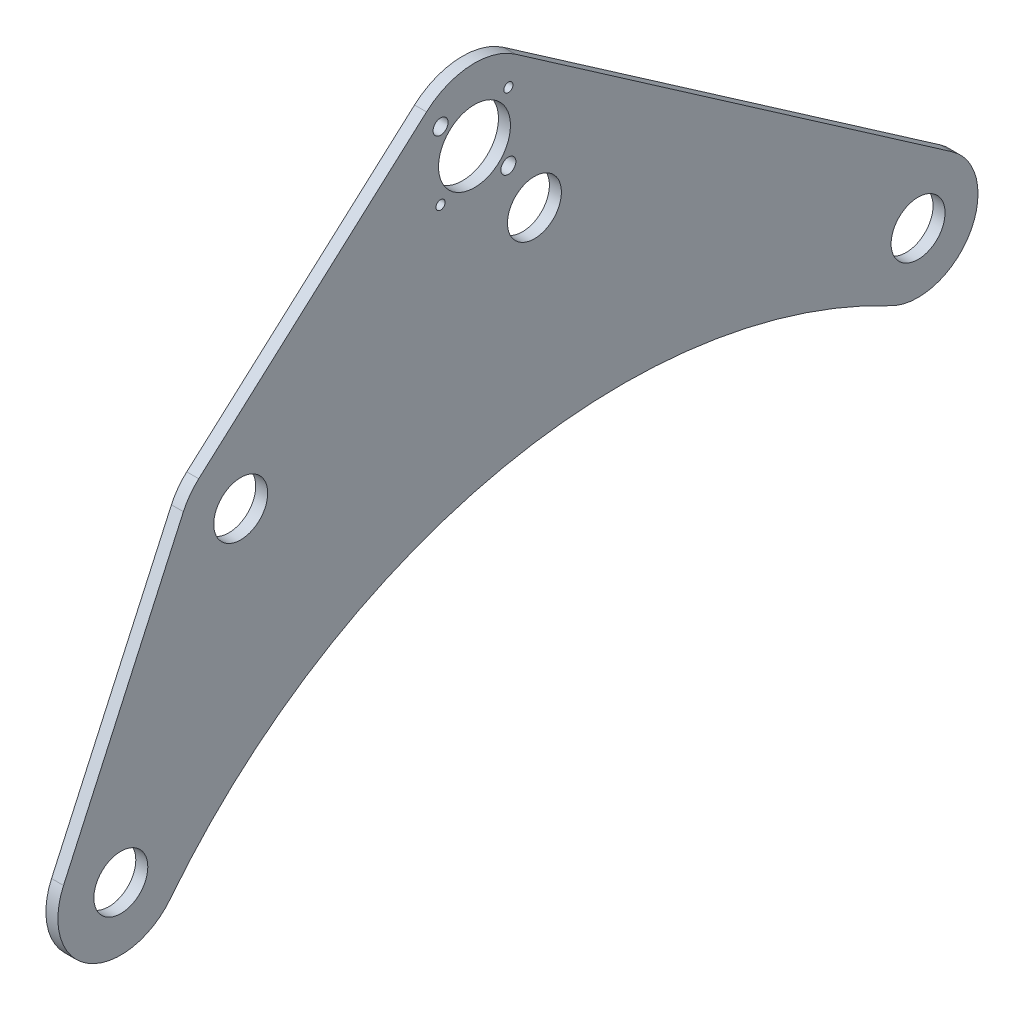
from build123d import *

# Parameters (mm, degrees)
BOSS_EXTRUDE1_DEPTH = 6.35
CUT_EXTRUDE1_REACH  = 496.96
SKETCH3_R           = 14.2875
SKETCH3_R_2         = 19.05
SKETCH3_R_3         = 2.413
SKETCH3_R_4         = 3.96875


with BuildPart() as part:
    # Sketch2 → Boss-Extrude1 (new body)
    with BuildSketch(Plane(origin=(0, 0, 0), x_dir=(0, 0, -1), z_dir=(1, 0, 0))):
        with BuildLine():
            Line((-452.624342442, -75.104844344), (-389.124342442, 64.595155656))
            ThreePointArc((-389.124342442, 64.595155656), (-385.638253391, 70.542201586), (-381.003559726, 75.645121025))
            Line((-381.003559726, 75.645121025), (-260.354068258, 183.588424029))
            ThreePointArc((-260.354068258, 183.588424029), (-237.302476246, 193.221304079), (-213.239358387, 186.503072818))
            Line((-213.239358387, 186.503072818), (18.092201344, 26.090894015))
            ThreePointArc((18.092201344, 26.090894015), (27.150656507, -16.459172252), (-14.764263766, -28.108344232))
            ThreePointArc((-14.764263766, -28.108344232), (-220.136392314, 0.134763987), (-396.071948893, -109.510410451))
            ThreePointArc((-396.071948893, -109.510410451), (-439.602252458, -117.380787007), (-452.624342442, -75.104844344))
        make_face()
    extrude(amount=BOSS_EXTRUDE1_DEPTH)

    # Sketch3 → Cut-Extrude1 (cut, up to next)
    with BuildSketch(Plane(origin=(6.35, 0, 0), x_dir=(0, 0, -1), z_dir=(1, 0, 0)), mode=Mode.PRIVATE) as cut_extrude1_sk1:
        with Locations((-203.2, 111.125)):
            Circle(SKETCH3_R)
    cut_extrude1_tool1 = extrude(cut_extrude1_sk1.sketch, amount=-CUT_EXTRUDE1_REACH, mode=Mode.PRIVATE) & part.part
    # Sketch3 → Cut-Extrude1 (cut, up to next)
    with BuildSketch(Plane(origin=(6.35, 0, 0), x_dir=(0, 0, -1), z_dir=(1, 0, 0)), mode=Mode.PRIVATE) as cut_extrude1_sk2:
        with Locations((-358.775, 50.8)):
            Circle(SKETCH3_R)
    cut_extrude1_tool2 = extrude(cut_extrude1_sk2.sketch, amount=-CUT_EXTRUDE1_REACH, mode=Mode.PRIVATE) & part.part
    # Sketch3 → Cut-Extrude1 (cut, up to next)
    with BuildSketch(Plane(origin=(6.35, 0, 0), x_dir=(0, 0, -1), z_dir=(1, 0, 0)), mode=Mode.PRIVATE) as cut_extrude1_sk3:
        with Locations((-422.275, -88.9)):
            Circle(SKETCH3_R)
    cut_extrude1_tool3 = extrude(cut_extrude1_sk3.sketch, amount=-CUT_EXTRUDE1_REACH, mode=Mode.PRIVATE) & part.part
    # Sketch3 → Cut-Extrude1 (cut, up to next)
    with BuildSketch(Plane(origin=(6.35, 0, 0), x_dir=(0, 0, -1), z_dir=(1, 0, 0)), mode=Mode.PRIVATE) as cut_extrude1_sk4:
        with Locations((-234.95, 155.194)):
            Circle(SKETCH3_R_2)
    cut_extrude1_tool4 = extrude(cut_extrude1_sk4.sketch, amount=-CUT_EXTRUDE1_REACH, mode=Mode.PRIVATE) & part.part
    # Sketch3 → Cut-Extrude1 (cut, up to next)
    with BuildSketch(Plane(origin=(6.35, 0, 0), x_dir=(0, 0, -1), z_dir=(1, 0, 0)), mode=Mode.PRIVATE) as cut_extrude1_sk5:
        Circle(SKETCH3_R)
    cut_extrude1_tool5 = extrude(cut_extrude1_sk5.sketch, amount=-CUT_EXTRUDE1_REACH, mode=Mode.PRIVATE) & part.part
    # Sketch3 → Cut-Extrude1 (cut, up to next)
    with BuildSketch(Plane(origin=(6.35, 0, 0), x_dir=(0, 0, -1), z_dir=(1, 0, 0)), mode=Mode.PRIVATE) as cut_extrude1_sk6:
        with Locations((-252.910512242, 137.233487758)):
            Circle(SKETCH3_R_3)
    cut_extrude1_tool6 = extrude(cut_extrude1_sk6.sketch, amount=-CUT_EXTRUDE1_REACH, mode=Mode.PRIVATE) & part.part
    # Sketch3 → Cut-Extrude1 (cut, up to next)
    with BuildSketch(Plane(origin=(6.35, 0, 0), x_dir=(0, 0, -1), z_dir=(1, 0, 0)), mode=Mode.PRIVATE) as cut_extrude1_sk7:
        with Locations((-216.989487758, 137.233487758)):
            Circle(SKETCH3_R_4)
    cut_extrude1_tool7 = extrude(cut_extrude1_sk7.sketch, amount=-CUT_EXTRUDE1_REACH, mode=Mode.PRIVATE) & part.part
    # Sketch3 → Cut-Extrude1 (cut, up to next)
    with BuildSketch(Plane(origin=(6.35, 0, 0), x_dir=(0, 0, -1), z_dir=(1, 0, 0)), mode=Mode.PRIVATE) as cut_extrude1_sk8:
        with Locations((-216.989487758, 173.154512242)):
            Circle(SKETCH3_R_3)
    cut_extrude1_tool8 = extrude(cut_extrude1_sk8.sketch, amount=-CUT_EXTRUDE1_REACH, mode=Mode.PRIVATE) & part.part
    # Sketch3 → Cut-Extrude1 (cut, up to next)
    with BuildSketch(Plane(origin=(6.35, 0, 0), x_dir=(0, 0, -1), z_dir=(1, 0, 0)), mode=Mode.PRIVATE) as cut_extrude1_sk9:
        with Locations((-252.910512242, 173.154512242)):
            Circle(SKETCH3_R_4)
    cut_extrude1_tool9 = extrude(cut_extrude1_sk9.sketch, amount=-CUT_EXTRUDE1_REACH, mode=Mode.PRIVATE) & part.part
    add(cut_extrude1_tool1.solids().sort_by_distance((6.35, 111.125, 203.2))[0], mode=Mode.SUBTRACT)
    add(cut_extrude1_tool2.solids().sort_by_distance((6.35, 50.8, 358.775))[0], mode=Mode.SUBTRACT)
    add(cut_extrude1_tool3.solids().sort_by_distance((6.35, -88.9, 422.275))[0], mode=Mode.SUBTRACT)
    add(cut_extrude1_tool4.solids().sort_by_distance((6.35, 155.194, 234.95))[0], mode=Mode.SUBTRACT)
    add(cut_extrude1_tool5.solids().sort_by_distance((6.35, 0, 0))[0], mode=Mode.SUBTRACT)
    add(cut_extrude1_tool6.solids().sort_by_distance((6.35, 137.233488, 252.910512))[0], mode=Mode.SUBTRACT)
    add(cut_extrude1_tool7.solids().sort_by_distance((6.35, 137.233488, 216.989488))[0], mode=Mode.SUBTRACT)
    add(cut_extrude1_tool8.solids().sort_by_distance((6.35, 173.154512, 216.989488))[0], mode=Mode.SUBTRACT)
    add(cut_extrude1_tool9.solids().sort_by_distance((6.35, 173.154512, 252.910512))[0], mode=Mode.SUBTRACT)


solid = part.part
